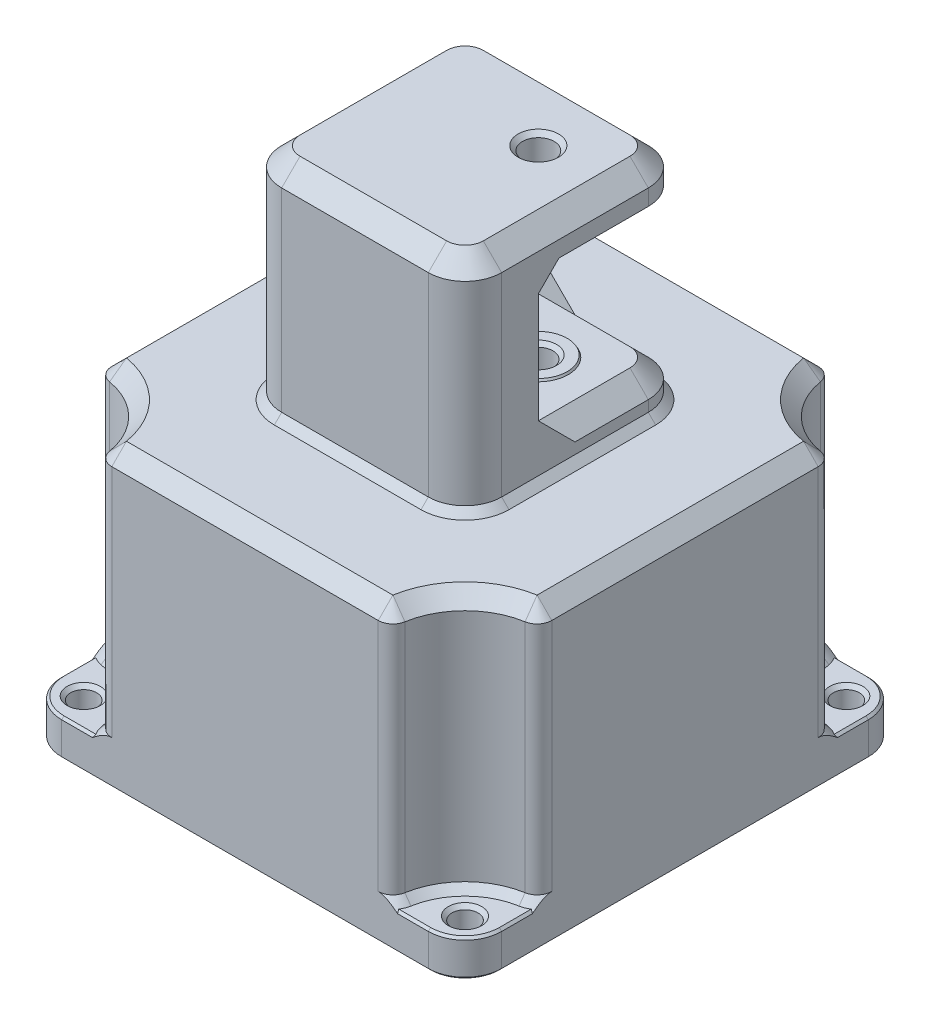
from build123d import *

# Parameters (mm, degrees)
BOSS_EXTRUDE1_DEPTH                  = 6.35
BOSS_EXTRUDE7_DEPTH                  = 50.8
SKETCH2_W                            = 38.1
SKETCH2_H                            = 38.1
BOSS_EXTRUDE2_DEPTH                  = 57.15
BOSS_EXTRUDE3_DEPTH                  = 82.55
BOSS_EXTRUDE4_START                  = 82.55
SKETCH2_5_W                          = 25.4
SKETCH2_5_H                          = 25.4
SKETCH2_5_R                          = 5
BOSS_EXTRUDE4_DEPTH                  = 6.35
BOSS_EXTRUDE6_START                  = 82.2
SKETCH2_7_R                          = 5
BOSS_EXTRUDE6_DEPTH                  = 0.35
BOSS_EXTRUDE6_DRAFT                  = -30
F_8_0_199_DIAMETER_HOLE1_D           = 5.0546
F_8_0_199_DIAMETER_HOLE1_DEPTH       = 8.89
F_8_0_199_DIAMETER_HOLE1_CSINK_D     = 6.3246
F_8_0_199_DIAMETER_HOLE1_CSINK_ANGLE = 90
F_8_0_199_DIAMETER_HOLE1_TIP         = 1.518555042
F_8_CLEARANCE_HOLE1_AT_2_COUNT       = 2
F_8_CLEARANCE_HOLE1_AT_2_PITCH       = 66.04
F_8_CLEARANCE_HOLE1_AT_3_COUNT       = 2
F_8_CLEARANCE_HOLE1_AT_3_PITCH       = 93.394663659
F_8_CLEARANCE_HOLE1_AT_4_COUNT       = 2
F_8_CLEARANCE_HOLE1_AT_4_PITCH       = 66.04
FILLET2_R                            = 6.35
FILLET4_R                            = 2.54
CHAMFER2_SIZE                        = 3.175
CHAMFER3_SIZE                        = 3.175
CHAMFER5_SIZE                        = 1.27
CHAMFER6_SIZE                        = 2.54
CHAMFER7_SIZE                        = 1.27
CHAMFER4_SIZE                        = 0.396875


# Read off the part's stored shape, not the designer's step: Boss-Extrude5
# Some blends are built 0.0001 mm under size
with BuildPart() as part:
    # Sketch1 → Boss-Extrude1 (new body)
    with BuildSketch(Plane(origin=(0, 0, 0), x_dir=(1, 0, 0), z_dir=(0, 1, 0))):
        with BuildLine():
            Line((-38.1, -25.4), (-38.1, -38.1))
            Line((-38.1, -38.1), (-25.4, -38.1))
            ThreePointArc((-25.4, -38.1), (-29.119743879, -29.119743879), (-38.1, -25.4))
        make_face()
        with BuildLine():
            ThreePointArc((-38.1, -25.4), (-29.119743879, -29.119743879), (-25.4, -38.1))
            Line((-25.4, -38.1), (25.4, -38.1))
            ThreePointArc((25.4, -38.1), (29.119743879, -29.119743879), (38.1, -25.4))
            Line((38.1, -25.4), (38.1, 25.4))
            ThreePointArc((38.1, 25.4), (29.119743879, 29.119743879), (25.4, 38.1))
            Line((25.4, 38.1), (-25.4, 38.1))
            ThreePointArc((-25.4, 38.1), (-29.119743879, 29.119743879), (-38.1, 25.4))
            Line((-38.1, 25.4), (-38.1, -25.4))
        make_face()
        with BuildLine():
            Line((-38.1, 38.1), (-38.1, 25.4))
            ThreePointArc((-38.1, 25.4), (-29.119743879, 29.119743879), (-25.4, 38.1))
            Line((-25.4, 38.1), (-38.1, 38.1))
        make_face()
        with BuildLine():
            ThreePointArc((25.4, 38.1), (29.119743879, 29.119743879), (38.1, 25.4))
            Line((38.1, 25.4), (38.1, 38.1))
            Line((38.1, 38.1), (25.4, 38.1))
        make_face()
        with BuildLine():
            ThreePointArc((38.1, -25.4), (29.119743879, -29.119743879), (25.4, -38.1))
            Line((25.4, -38.1), (38.1, -38.1))
            Line((38.1, -38.1), (38.1, -25.4))
        make_face()
    extrude(amount=BOSS_EXTRUDE1_DEPTH)

    # Sketch1<3> → Boss-Extrude7 (add)
    with BuildSketch(Plane(origin=(0, 0, 0), x_dir=(1, 0, 0), z_dir=(0, 1, 0))):
        with BuildLine():
            ThreePointArc((-38.1, -25.4), (-29.119743879, -29.119743879), (-25.4, -38.1))
            Line((-25.4, -38.1), (25.4, -38.1))
            ThreePointArc((25.4, -38.1), (29.119743879, -29.119743879), (38.1, -25.4))
            Line((38.1, -25.4), (38.1, 25.4))
            ThreePointArc((38.1, 25.4), (29.119743879, 29.119743879), (25.4, 38.1))
            Line((25.4, 38.1), (-25.4, 38.1))
            ThreePointArc((-25.4, 38.1), (-29.119743879, 29.119743879), (-38.1, 25.4))
            Line((-38.1, 25.4), (-38.1, -25.4))
        make_face()
    extrude(amount=BOSS_EXTRUDE7_DEPTH)

    # Sketch2 → Boss-Extrude2 (add)
    with BuildSketch(Plane(origin=(0, 0, 0), x_dir=(1, 0, 0), z_dir=(0, 1, 0))):
        Rectangle(SKETCH2_W, SKETCH2_H)
    extrude(amount=BOSS_EXTRUDE2_DEPTH)

    # Sketch2<3> → Boss-Extrude3 (add)
    with BuildSketch(Plane(origin=(0, 0, 0), x_dir=(1, 0, 0), z_dir=(0, 1, 0))):
        Polygon((-19.05, 19.05), (-19.05, -19.05), (19.05, -19.05), (19.05, -6.35), (-6.35, -6.35), (-6.35, 19.05), align=None)
    extrude(amount=BOSS_EXTRUDE3_DEPTH)

    # Sketch2<5> → Boss-Extrude4 (add)
    # profile 1 of 3: a face of its own
    with BuildSketch(Plane(origin=(0, 0, 0), x_dir=(1, 0, 0), z_dir=(0, 1, 0)).offset(BOSS_EXTRUDE4_START)):
        Polygon((-19.05, 19.05), (-19.05, -19.05), (19.05, -19.05), (19.05, -6.35), (-6.35, -6.35), (-6.35, 19.05), align=None)
    # profile 2 of 3: a face of its own
    with BuildSketch(Plane(origin=(0, 0, 0), x_dir=(1, 0, 0), z_dir=(0, 1, 0)).offset(BOSS_EXTRUDE4_START)):
        with Locations((6.35, 6.35)):
            Rectangle(SKETCH2_5_W, SKETCH2_5_H)
        with Locations((6.35, 6.35)):
            Circle(SKETCH2_5_R, mode=Mode.SUBTRACT)
    # profile 3 of 3: a face of its own
    with BuildSketch(Plane(origin=(0, 0, 0), x_dir=(1, 0, 0), z_dir=(0, 1, 0)).offset(BOSS_EXTRUDE4_START)):
        with Locations((6.35, 6.35)):
            Circle(SKETCH2_5_R)
    extrude(amount=BOSS_EXTRUDE4_DEPTH)

    # Boss-Extrude5 outline → Boss-Extrude5 (revolve)
    with BuildSketch(Plane(origin=(6.35, 0, -6.35), x_dir=(1, 0, 0), z_dir=(0, 0, 1))):
        Polygon((5, 57.5), (0, 57.5), (0, 57.15), (5.202072594, 57.15), align=None)
    revolve(axis=Axis((6.35, 0, -6.35), (0, 1, 0)))


with BuildPart() as boss_extrude6_tool:
    # Sketch2<7> → Boss-Extrude6 (with draft: the straight prism first)
    with BuildSketch(Plane(origin=(0, 0, 0), x_dir=(1, 0, 0), z_dir=(0, 1, 0)).offset(BOSS_EXTRUDE6_START)):
        with Locations((6.35, 6.35)):
            Circle(SKETCH2_7_R)
    extrude(amount=BOSS_EXTRUDE6_DEPTH)
    # Boss-Extrude6: the draft: its side faces are tilted about the plane it starts from
    boss_extrude6_sides = [boss_extrude6_tool.faces().sort_by_distance(p)[0] for p in [
        (1.35, 82.375, -6.35),
    ]]
    draft(boss_extrude6_sides, Plane(origin=(0, 0, 0), x_dir=(1, 0, 0), z_dir=(0, 1, 0)).offset(BOSS_EXTRUDE6_START), BOSS_EXTRUDE6_DRAFT)


with BuildPart() as part_1:
    add(part.part)

    # Boss-Extrude6: add boss_extrude6_tool
    add(boss_extrude6_tool.part)

    # #8 (0.199) Diameter Hole1
    with Locations(Plane(origin=(0, 57.5, 0), x_dir=(1, 0, 0), z_dir=(0, 1, 0))):
        with Locations((6.35, 6.35)):
            CounterSinkHole(F_8_0_199_DIAMETER_HOLE1_D / 2, F_8_0_199_DIAMETER_HOLE1_CSINK_D / 2, depth=F_8_0_199_DIAMETER_HOLE1_DEPTH, counter_sink_angle=F_8_0_199_DIAMETER_HOLE1_CSINK_ANGLE)
            with Locations((0, 0, -(F_8_0_199_DIAMETER_HOLE1_DEPTH + F_8_0_199_DIAMETER_HOLE1_TIP / 2))):  # 118° drill point
                Cone(0, F_8_0_199_DIAMETER_HOLE1_D / 2, F_8_0_199_DIAMETER_HOLE1_TIP, mode=Mode.SUBTRACT)

    # Sketch8 → M5 Clearance Hole1 (revolve, cut)
    with BuildSketch(Plane(origin=(6.35, 82.2, -6.35), x_dir=(0, 0, -1), z_dir=(1, 0, 0))):
        Polygon((0, 0), (0, 6.7), (3.5, 6.7), (2.75, 5.95), (2.75, 0.75), (3.5, 0), align=None)
    revolve(axis=Axis((6.35, 75.85, -6.35), (0, 1, 0)), mode=Mode.SUBTRACT)

    # Sketch17 → #8 Clearance Hole1 (revolve, cut)
    with BuildSketch(Plane(origin=(-33.02, 6.35, -33.02), x_dir=(0, 0, 1), z_dir=(1, 0, 0))):
        Polygon((0, 0), (0, 6.35), (2.8829, 6.35), (2.2479, 5.715), (2.2479, 0.635), (2.8829, 0), align=None)
    f_8_clearance_hole1 = revolve(axis=Axis((-33.02, 12.7, -33.02), (0, -1, 0)), mode=Mode.SUBTRACT)

    # #8 Clearance Hole1 at 2: #8 Clearance Hole1 ×2
    with Locations(*[(i * F_8_CLEARANCE_HOLE1_AT_2_PITCH, 0, 0) for i in range(1, F_8_CLEARANCE_HOLE1_AT_2_COUNT)]):
        add(f_8_clearance_hole1, mode=Mode.SUBTRACT)

    # #8 Clearance Hole1 at 3: #8 Clearance Hole1 ×2
    with Locations(*[Vector(0.7071067811865476, 0, 0.7071067811865476) * (i * F_8_CLEARANCE_HOLE1_AT_3_PITCH) for i in range(1, F_8_CLEARANCE_HOLE1_AT_3_COUNT)]):
        add(f_8_clearance_hole1, mode=Mode.SUBTRACT)

    # #8 Clearance Hole1 at 4: #8 Clearance Hole1 ×2
    with Locations(*[(0, 0, i * F_8_CLEARANCE_HOLE1_AT_4_PITCH) for i in range(1, F_8_CLEARANCE_HOLE1_AT_4_COUNT)]):
        add(f_8_clearance_hole1, mode=Mode.SUBTRACT)

    # Fillet2
    fillet2_edges = [part_1.edges().sort_by_distance(p)[0] for p in [
        (-6.35, 69.85, 6.35),
        (-38.1, 3.175, 38.1),
        (-38.1, 3.175, -38.1),
        (38.1, 3.175, -38.1),
        (38.1, 3.175, 38.1),
        (19.05, 85.725, -19.05),
        (19.05, 53.975, -19.05),
        (-19.05, 69.85, -19.05),
        (-19.05, 69.85, 19.05),
        (19.05, 69.85, 19.05),
    ]]
    fillet(fillet2_edges, radius=FILLET2_R)

    # Fillet4
    fillet4_edges = [part_1.edges().sort_by_distance(p)[0] for p in [
        (-25.4, 28.575, 38.1),
        (25.4, 28.575, 38.1),
        (38.1, 28.575, 25.4),
        (38.1, 28.575, -25.4),
        (25.4, 28.575, -38.1),
        (-25.4, 28.575, -38.1),
        (-38.1, 28.575, -25.4),
        (-38.1, 28.575, 25.4),
    ]]
    fillet(fillet4_edges, radius=FILLET4_R)

    # Chamfer2
    chamfer2_edges = [part_1.edges().sort_by_distance(p)[0] for p in [
        (-6.35, 82.55, -9.525),
        (9.525, 82.55, 6.35),
        (-6.35, 57.15, -9.525),
        (9.525, 57.15, 6.35),
        (-4.490128061, 57.15, 4.490128061),
        (-4.490128061, 82.55, 4.490128061),
    ]]
    chamfer(chamfer2_edges, length=CHAMFER2_SIZE)

    # Chamfer3
    chamfer3_edges = [part_1.edges().sort_by_distance(p)[0] for p in [
        (17.190128061, 57.15, -17.190128061),
        (0, 88.9, -19.05),
        (19.05, 88.9, 0),
        (-19.05, 88.9, 0),
        (0, 88.9, 19.05),
        (17.190128061, 88.9, 17.190128061),
        (-17.190128061, 88.9, 17.190128061),
        (-17.190128061, 88.9, -17.190128061),
        (17.190128061, 88.9, -17.190128061),
        (19.05, 57.15, -4.7625),
        (4.7625, 57.15, -19.05),
    ]]
    chamfer(chamfer3_edges, length=CHAMFER3_SIZE)

    # Chamfer5
    chamfer5_edges = [part_1.edges().sort_by_distance(p)[0] for p in [
        (0, 50.8, -19.05),
        (19.05, 50.8, 0),
        (-19.05, 50.8, 0),
        (0, 50.8, 19.05),
        (-17.190128061, 50.8, -17.190128061),
        (17.190128061, 50.8, -17.190128061),
        (-17.190128061, 50.8, 17.190128061),
        (17.190128061, 50.8, 17.190128061),
    ]]
    chamfer(chamfer5_edges, length=CHAMFER5_SIZE)

    # Chamfer6
    chamfer6_edges = [part_1.edges().sort_by_distance(p)[0] for p in [
        (-38.1, 50.8, 0),
        (-29.119743879, 50.8, -29.119743879),
        (0, 50.8, 38.1),
        (29.119743879, 50.8, 29.119743879),
        (38.1, 50.8, 0),
        (29.119743879, 50.8, -29.119743879),
        (0, 50.8, -38.1),
        (-29.119743879, 50.8, 29.119743879),
        (24.712720301, 50.8, 37.499957044),
        (37.499957044, 50.8, 24.712720301),
        (37.499957044, 50.8, -24.712720301),
        (24.712720301, 50.8, -37.499957044),
        (-24.712720301, 50.8, 37.499957044),
        (-37.499957044, 50.8, 24.712720301),
        (-24.712720301, 50.8, -37.499957044),
        (-37.499957044, 50.8, -24.712720301),
    ]]
    chamfer(chamfer6_edges, length=CHAMFER6_SIZE - 0.0001)  # a hair under: the kernel refuses the full size

    # Chamfer7
    # the kernel refuses this chamfer: 1.27 mm, written as the material it adds along each edge
    with BuildSketch(Plane(origin=(-38.1, 6.35, -38.1), x_dir=(0.9860132971832694, 0, 0.1666666666666668), z_dir=(0.1666666666666668, 0, -0.9860132971832694))) as chamfer7_piece_1:
        Polygon((12.7, -CHAMFER7_SIZE), (12.7 - CHAMFER7_SIZE, 0), (12.7, 0), align=None)
    revolve(axis=Axis((-38.1, 6.35, -38.1), (0, -1, 0)), revolution_arc=70.811863546)
    with BuildSketch(Plane(origin=(-38.1, 6.35, 38.1), x_dir=(0.16666666666666616, 0, -0.9860132971832694), z_dir=(-0.9860132971832694, 0, -0.16666666666666616))) as chamfer7_piece_2:
        Polygon((12.7, -CHAMFER7_SIZE), (12.7 - CHAMFER7_SIZE, 0), (12.7, 0), align=None)
    revolve(axis=Axis((-38.1, 6.35, 38.1), (0, -1, 0)), revolution_arc=70.811863546)
    with BuildSketch(Plane(origin=(38.1, 6.35, -38.1), x_dir=(-0.1666666666666665, 0, 0.9860132971832694), z_dir=(0.9860132971832694, 0, 0.1666666666666665))) as chamfer7_piece_3:
        Polygon((12.7, -CHAMFER7_SIZE), (12.7 - CHAMFER7_SIZE, 0), (12.7, 0), align=None)
    revolve(axis=Axis((38.1, 6.35, -38.1), (0, -1, 0)), revolution_arc=70.811863546)
    with BuildSketch(Plane(origin=(38.1, 6.35, 38.1), x_dir=(-0.986013297183269, 0, -0.16666666666666893), z_dir=(-0.16666666666666893, 0, 0.986013297183269))) as chamfer7_piece_4:
        Polygon((12.7, -CHAMFER7_SIZE), (12.7 - CHAMFER7_SIZE, 0), (12.7, 0), align=None)
    revolve(axis=Axis((38.1, 6.35, 38.1), (0, -1, 0)), revolution_arc=70.811863546)
    with BuildSketch(Plane(origin=(-35.56, 6.35, -23.073157351), x_dir=(-0.2807184525796538, 0, 0.9597901595563922), z_dir=(0.9597901595563922, 0, 0.2807184525796538))) as chamfer7_piece_5_section:
        Polygon((2.54, -CHAMFER7_SIZE), (2.54 + CHAMFER7_SIZE, 0), (2.54, 0), align=None)
    chamfer7_piece_5 = revolve(axis=Axis((-35.56, 6.35, -23.073157351), (0, -1, 0)), revolution_arc=154.1028429, mode=Mode.PRIVATE)
    chamfer7_piece_5 = split(chamfer7_piece_5, bisect_by=Plane(origin=(-38.1, 6.870447209, -24.8557184), z_dir=(1, 0, 0)), keep=Keep.TOP, mode=Mode.PRIVATE)
    add(chamfer7_piece_5)
    with BuildSketch(Plane(origin=(-23.073157351, 6.35, -35.56), x_dir=(-0.986013297183269, 0, -0.16666666666666888), z_dir=(-0.16666666666666888, 0, 0.986013297183269))) as chamfer7_piece_6_section:
        Polygon((2.54, -CHAMFER7_SIZE), (2.54 + CHAMFER7_SIZE, 0), (2.54, 0), align=None)
    chamfer7_piece_6 = revolve(axis=Axis((-23.073157351, 6.35, -35.56), (0, -1, 0)), revolution_arc=154.1028429, mode=Mode.PRIVATE)
    chamfer7_piece_6 = split(chamfer7_piece_6, bisect_by=Plane(origin=(-24.855718177, 6.870446862, -38.1), z_dir=(0, 0, 1)), keep=Keep.TOP, mode=Mode.PRIVATE)
    add(chamfer7_piece_6)
    with BuildSketch(Plane(origin=(-35.56, 6.35, 23.073157351), x_dir=(-0.2807184525796567, 0, -0.9597901595563914), z_dir=(0.9597901595563914, 0, -0.2807184525796567))) as chamfer7_piece_7_section:
        Polygon((2.54, CHAMFER7_SIZE), (2.54 + CHAMFER7_SIZE, 0), (2.54, 0), align=None)
    chamfer7_piece_7 = revolve(axis=Axis((-35.56, 6.35, 23.073157351), (0, 1, 0)), revolution_arc=154.1028429, mode=Mode.PRIVATE)
    chamfer7_piece_7 = split(chamfer7_piece_7, bisect_by=Plane(origin=(-38.1, 6.870447528, 24.855717867), z_dir=(1, 0, 0)), keep=Keep.TOP, mode=Mode.PRIVATE)
    add(chamfer7_piece_7)
    with BuildSketch(Plane(origin=(-23.073157351, 6.35, 35.56), x_dir=(-0.9860132971832694, 0, 0.16666666666666613), z_dir=(-0.16666666666666613, 0, -0.9860132971832694))) as chamfer7_piece_8_section:
        Polygon((2.54, CHAMFER7_SIZE), (2.54 + CHAMFER7_SIZE, 0), (2.54, 0), align=None)
    chamfer7_piece_8 = revolve(axis=Axis((-23.073157351, 6.35, 35.56), (0, 1, 0)), revolution_arc=154.1028429, mode=Mode.PRIVATE)
    chamfer7_piece_8 = split(chamfer7_piece_8, bisect_by=Plane(origin=(-24.855718507, 6.870447099, 38.1), z_dir=(0, 0, -1)), keep=Keep.TOP, mode=Mode.PRIVATE)
    add(chamfer7_piece_8)
    with BuildSketch(Plane(origin=(23.073157351, 6.35, -35.56), x_dir=(-0.9597901595563914, 0, -0.2807184525796567), z_dir=(-0.2807184525796567, 0, 0.9597901595563914))) as chamfer7_piece_9_section:
        Polygon((2.54, -CHAMFER7_SIZE), (2.54 + CHAMFER7_SIZE, 0), (2.54, 0), align=None)
    chamfer7_piece_9 = revolve(axis=Axis((23.073157351, 6.35, -35.56), (0, -1, 0)), revolution_arc=154.1028429, mode=Mode.PRIVATE)
    chamfer7_piece_9 = split(chamfer7_piece_9, bisect_by=Plane(origin=(24.8557184, 6.870447209, -38.1), z_dir=(0, 0, 1)), keep=Keep.TOP, mode=Mode.PRIVATE)
    add(chamfer7_piece_9)
    with BuildSketch(Plane(origin=(35.56, 6.35, -23.073157351), x_dir=(0.2807184525796567, 0, 0.9597901595563914), z_dir=(-0.9597901595563914, 0, 0.2807184525796567))) as chamfer7_piece_10_section:
        Polygon((2.54, CHAMFER7_SIZE), (2.54 + CHAMFER7_SIZE, 0), (2.54, 0), align=None)
    chamfer7_piece_10 = revolve(axis=Axis((35.56, 6.35, -23.073157351), (0, 1, 0)), revolution_arc=154.1028429, mode=Mode.PRIVATE)
    chamfer7_piece_10 = split(chamfer7_piece_10, bisect_by=Plane(origin=(38.1, 6.870447528, -24.855717867), z_dir=(-1, 0, 0)), keep=Keep.TOP, mode=Mode.PRIVATE)
    add(chamfer7_piece_10)
    with BuildSketch(Plane(origin=(35.56, 6.35, 23.073157351), x_dir=(0.2807184525796508, 0, -0.959790159556393), z_dir=(-0.959790159556393, 0, -0.2807184525796508))) as chamfer7_piece_11_section:
        Polygon((2.54, -CHAMFER7_SIZE), (2.54 + CHAMFER7_SIZE, 0), (2.54, 0), align=None)
    chamfer7_piece_11 = revolve(axis=Axis((35.56, 6.35, 23.073157351), (0, -1, 0)), revolution_arc=154.1028429, mode=Mode.PRIVATE)
    chamfer7_piece_11 = split(chamfer7_piece_11, bisect_by=Plane(origin=(38.1, 6.870447209, 24.8557184), z_dir=(-1, 0, 0)), keep=Keep.TOP, mode=Mode.PRIVATE)
    add(chamfer7_piece_11)
    with BuildSketch(Plane(origin=(23.073157351, 6.35, 35.56), x_dir=(-0.9597901595563914, 0, 0.2807184525796567), z_dir=(-0.2807184525796567, 0, -0.9597901595563914))) as chamfer7_piece_12_section:
        Polygon((2.54, CHAMFER7_SIZE), (2.54 + CHAMFER7_SIZE, 0), (2.54, 0), align=None)
    chamfer7_piece_12 = revolve(axis=Axis((23.073157351, 6.35, 35.56), (0, 1, 0)), revolution_arc=154.1028429, mode=Mode.PRIVATE)
    chamfer7_piece_12 = split(chamfer7_piece_12, bisect_by=Plane(origin=(24.855717867, 6.870447528, 38.1), z_dir=(0, 0, -1)), keep=Keep.TOP, mode=Mode.PRIVATE)
    add(chamfer7_piece_12)

    # Chamfer4
    chamfer4_edges = [part_1.edges().sort_by_distance(p)[0] for p in [
        (4.7625, 82.55, -19.05),
        (19.05, 82.55, -4.7625),
        (17.190128061, 82.55, -17.190128061),
        (-38.1, 0, 0),
        (-38.1, 6.35, 28.831481841),
        (0, 0, -38.1),
        (38.1, 0, 0),
        (0, 0, 38.1),
        (36.240128061, 0, -36.240128061),
        (36.240128061, 0, 36.240128061),
        (-36.240128061, 0, 36.240128061),
        (-36.240128061, 0, -36.240128061),
        (-28.831481841, 6.35, -38.1),
        (-36.240128061, 6.35, -36.240128061),
        (-28.831481841, 6.35, 38.1),
        (-36.240128061, 6.35, 36.240128061),
        (38.1, 6.35, 28.831481841),
        (36.240128061, 6.35, 36.240128061),
        (36.240128061, 6.35, -36.240128061),
        (28.831481841, 6.35, 38.1),
        (38.1, 6.35, -28.831481841),
        (28.831481841, 6.35, -38.1),
        (-38.1, 6.35, -28.831481841),
    ]]
    chamfer(chamfer4_edges, length=CHAMFER4_SIZE)


solid = part_1.part
